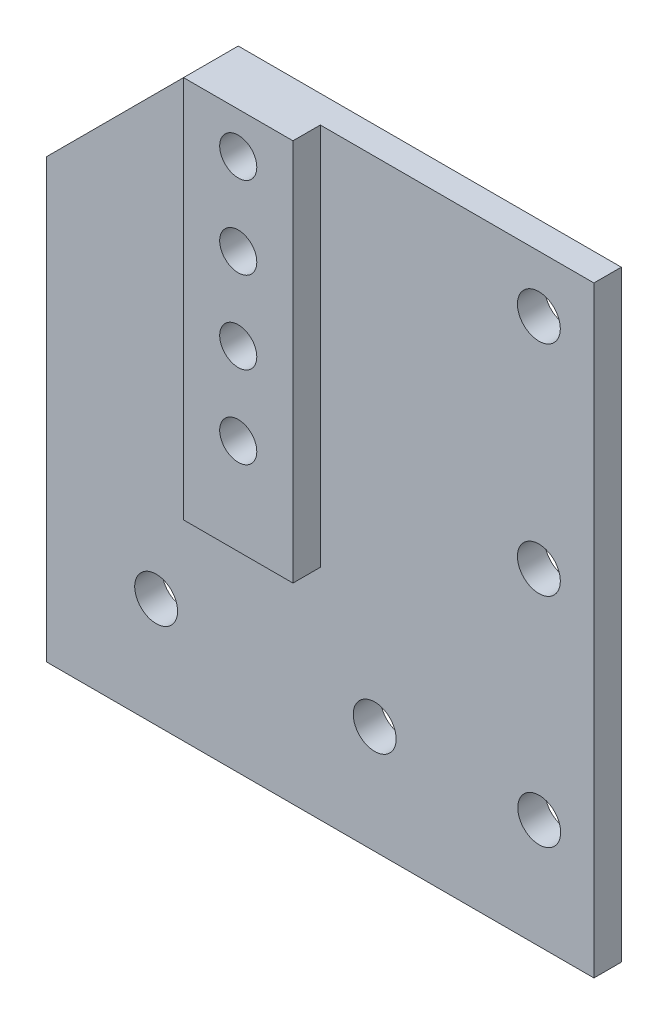
from build123d import *

# Parameters (mm, degrees)
BOSS_EXTRUDE1_DEPTH    = 3.175
F_10_CLEARANCE_HOLE1_D = 4.9784
SKETCH5_W              = 12.7
SKETCH5_H              = 44.45
BOSS_EXTRUDE2_DEPTH    = 3.175
F_8_CLEARANCE_HOLE1_D  = 4.3053


with BuildPart() as part:
    # Sketch1 → Boss-Extrude1 (new body)
    with BuildSketch(Plane.XY):
        Polygon((-266.700000508, -12.7), (-266.700000508, 57.15), (-279.400000508, 57.15), (-311.150000508, 57.15), (-330.200000508, 38.1), (-330.200000508, 12.7), (-330.200000508, -12.7), (-279.400000508, -12.7), align=None)
    extrude(amount=BOSS_EXTRUDE1_DEPTH)

    # #10 Clearance Hole1 (through all)
    with Locations(Plane.XY.offset(3.175)):
        with Locations((-273.088229923, 50.598316496), (-273.088229923, 25.236545911), (-273.050000508, 0), (-317.500000508, 0), (-292.138229923, -0.163454089)):
            Hole(F_10_CLEARANCE_HOLE1_D / 2)

    # Sketch5 → Boss-Extrude2 (add)
    with BuildSketch(Plane.XY.offset(3.175)):
        with Locations((-304.800000508, 34.925)):
            Rectangle(SKETCH5_W, SKETCH5_H)
    extrude(amount=BOSS_EXTRUDE2_DEPTH)

    # #8 Clearance Hole1 (through all)
    with Locations(Plane.XY.offset(6.35)):
        with Locations((-304.800000508, 42.8625), (-304.800000508, 52.3875), (-304.800000508, 33.3375), (-304.800000508, 23.8125)):
            Hole(F_8_CLEARANCE_HOLE1_D / 2)


solid = part.part
